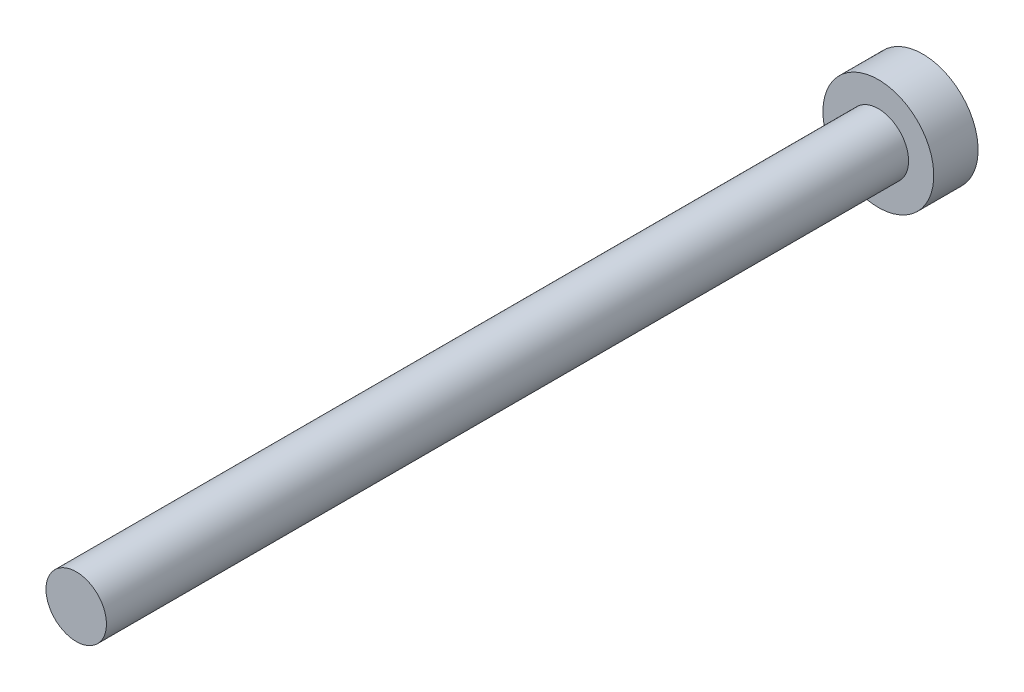
from build123d import *

# Parameters (mm, degrees)
SKETCH1_R           = 1.5
BOSS_EXTRUDE1_DEPTH = 42
SKETCH2_R           = 2.75
BOSS_EXTRUDE2_DEPTH = 2.2


with BuildPart() as part:
    # Sketch1 → Boss-Extrude1 (new body)
    with BuildSketch(Plane.XY):
        Circle(SKETCH1_R)
    extrude(amount=BOSS_EXTRUDE1_DEPTH)

    # Sketch2 → Boss-Extrude2 (add)
    with BuildSketch(Plane(origin=(0, 0, 0), x_dir=(-1, 0, 0), z_dir=(0, 0, -1))):
        Circle(SKETCH2_R)
    extrude(amount=-BOSS_EXTRUDE2_DEPTH)


solid = part.part
